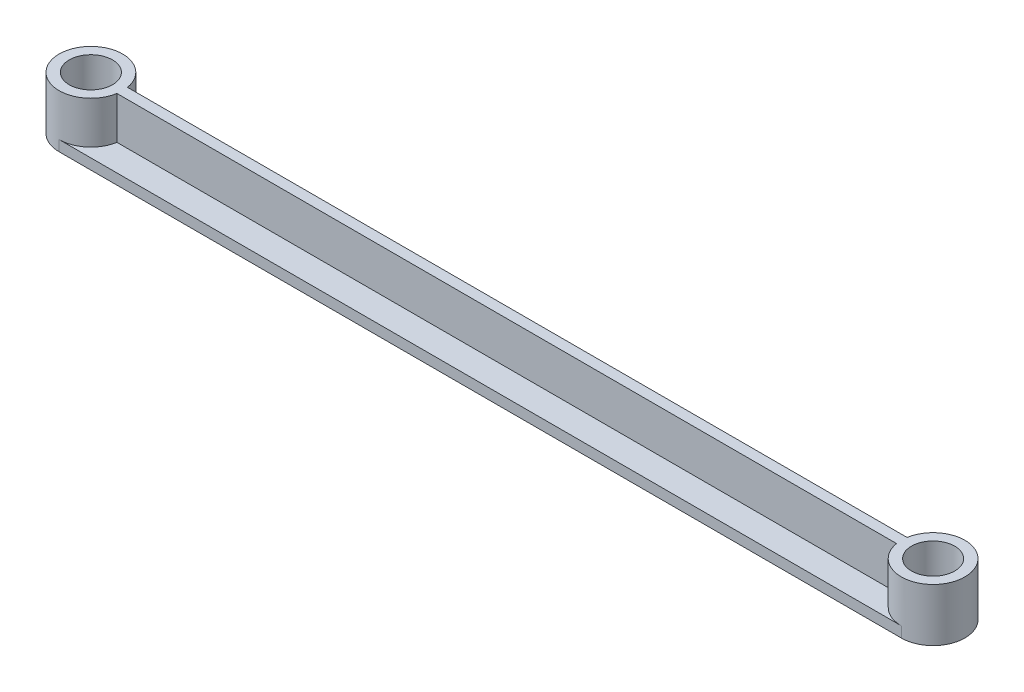
from build123d import *
from build123d.topology import SkipClean

# Parameters (mm, degrees)
BOSS_EXTRUDE1_DEPTH                  = 1.5875
SKETCH2_R                            = 4.7625
SKETCH2_R_2                          = 3.2385
BOSS_EXTRUDE2_DEPTH                  = 6.35
BOSS_EXTRUDE3_REACH                  = 158.74
BOSS_EXTRUDE3_END_RADIUS             = 4.7625
BOSS_EXTRUDE3_START                  = -25.4
SKETCH3_W                            = 1.5875
SKETCH3_H                            = 6.35
BOSS_EXTRUDE3_DIRECTION_2_REACH      = 158.74
BOSS_EXTRUDE3_DIRECTION_2_END_RADIUS = 4.7625


with BuildPart() as part:
    # Sketch1 → Boss-Extrude1 (new body)
    with BuildSketch(Plane(origin=(0, 0, 0), x_dir=(1, 0, 0), z_dir=(0, 1, 0))):
        with BuildLine():
            Line((0, -4.7625), (-126.2507, -4.7625))
            ThreePointArc((-126.2507, -4.7625), (-131.0132, 0), (-126.2507, 4.7625))
            Line((-126.2507, 4.7625), (0, 4.7625))
            ThreePointArc((0, 4.7625), (4.7625, 0), (0, -4.7625))
        make_face()
    extrude(amount=BOSS_EXTRUDE1_DEPTH)

    # Sketch2 → Boss-Extrude2 (add)
    # profile 1 of 2: a face of its own
    with SkipClean():  # the faces are left unmerged after this step: merging them gives an invalid solid
        with BuildSketch(Plane(origin=(0, 1.5875, 0), x_dir=(1, 0, 0), z_dir=(0, 1, 0))):
            with Locations(Location((-126.2507, 0, 0), (0, 0, 270))):
                Circle(SKETCH2_R)
            with Locations(Location((-126.2507, 0, 0), (0, 0, 270))):
                Circle(SKETCH2_R_2, mode=Mode.SUBTRACT)
        # profile 2 of 2: a face of its own
        with BuildSketch(Plane(origin=(0, 1.5875, 0), x_dir=(1, 0, 0), z_dir=(0, 1, 0))):
            with Locations(Location((0, 0, 0), (0, 0, 270))):
                Circle(SKETCH2_R)
            with Locations(Location((0, 0, 0), (0, 0, 270))):
                Circle(SKETCH2_R_2, mode=Mode.SUBTRACT)
        extrude(amount=BOSS_EXTRUDE2_DEPTH)

    # Boss-Extrude3: up to this cylinder (the profile starts outside it)
    with SkipClean():  # the faces are left unmerged after this step: merging them gives an invalid solid
        boss_extrude3_end = Plane(origin=(-126.2507, 4.7625, 0), z_dir=(0, -1, 0)) * Cylinder(BOSS_EXTRUDE3_END_RADIUS, 328.005, mode=Mode.PRIVATE)
        # Sketch3 → Boss-Extrude3 (add, up to the surface)
        with BuildSketch(Plane(origin=(0, 0, 0), x_dir=(0, 0, -1), z_dir=(1, 0, 0)).offset(BOSS_EXTRUDE3_START), mode=Mode.PRIVATE) as boss_extrude3_sk1:
            with Locations((0, 4.7625)):
                Rectangle(SKETCH3_W, SKETCH3_H)
        boss_extrude3_tool1 = extrude(boss_extrude3_sk1.sketch, amount=-BOSS_EXTRUDE3_REACH, mode=Mode.PRIVATE) - boss_extrude3_end
        add(boss_extrude3_tool1.solids().sort_by_distance((-25.4, 4.7625, 0))[0])
    add(part.part.scale(1), mode=Mode.REPLACE)  # the faces are merged on a copy

    # Boss-Extrude3 direction 2: up to this cylinder (the profile starts outside it)
    boss_extrude3_direction_2_end = Plane(origin=(0, 4.7625, 0), z_dir=(0, -1, 0)) * Cylinder(BOSS_EXTRUDE3_DIRECTION_2_END_RADIUS, 328.005, mode=Mode.PRIVATE)
    # Sketch3 → Boss-Extrude3 direction 2 (add, up to the surface)
    with BuildSketch(Plane(origin=(0, 0, 0), x_dir=(0, 0, -1), z_dir=(1, 0, 0)).offset(BOSS_EXTRUDE3_START), mode=Mode.PRIVATE) as boss_extrude3_direction_2_sk1:
        with Locations((0, 4.7625)):
            Rectangle(SKETCH3_W, SKETCH3_H)
    boss_extrude3_direction_2_tool1 = extrude(boss_extrude3_direction_2_sk1.sketch, amount=BOSS_EXTRUDE3_DIRECTION_2_REACH, mode=Mode.PRIVATE) - boss_extrude3_direction_2_end
    add(boss_extrude3_direction_2_tool1.solids().sort_by_distance((-25.4, 4.7625, 0))[0])


solid = part.part
